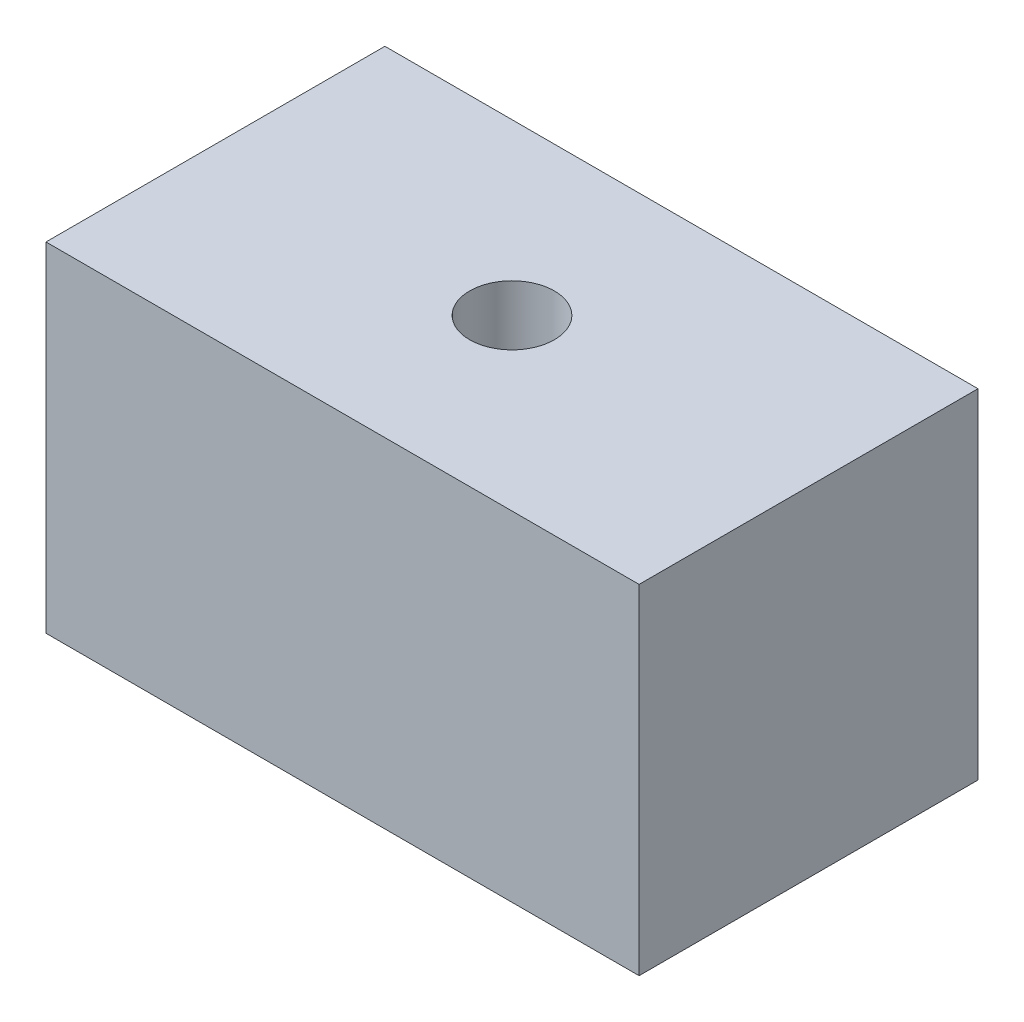
from build123d import *

# Parameters (mm, degrees)
SKETCH1_W           = 88.9
SKETCH1_H           = 50.8
SKETCH1_R           = 6.35
BOSS_EXTRUDE2_DEPTH = 50.8


with BuildPart() as part:
    # Sketch1 → Boss-Extrude2 (new body)
    with BuildSketch(Plane(origin=(0, 0, 0), x_dir=(1, 0, 0), z_dir=(0, 1, 0))):
        Rectangle(SKETCH1_W, SKETCH1_H)
        Circle(SKETCH1_R, mode=Mode.SUBTRACT)
    extrude(amount=BOSS_EXTRUDE2_DEPTH)


solid = part.part
